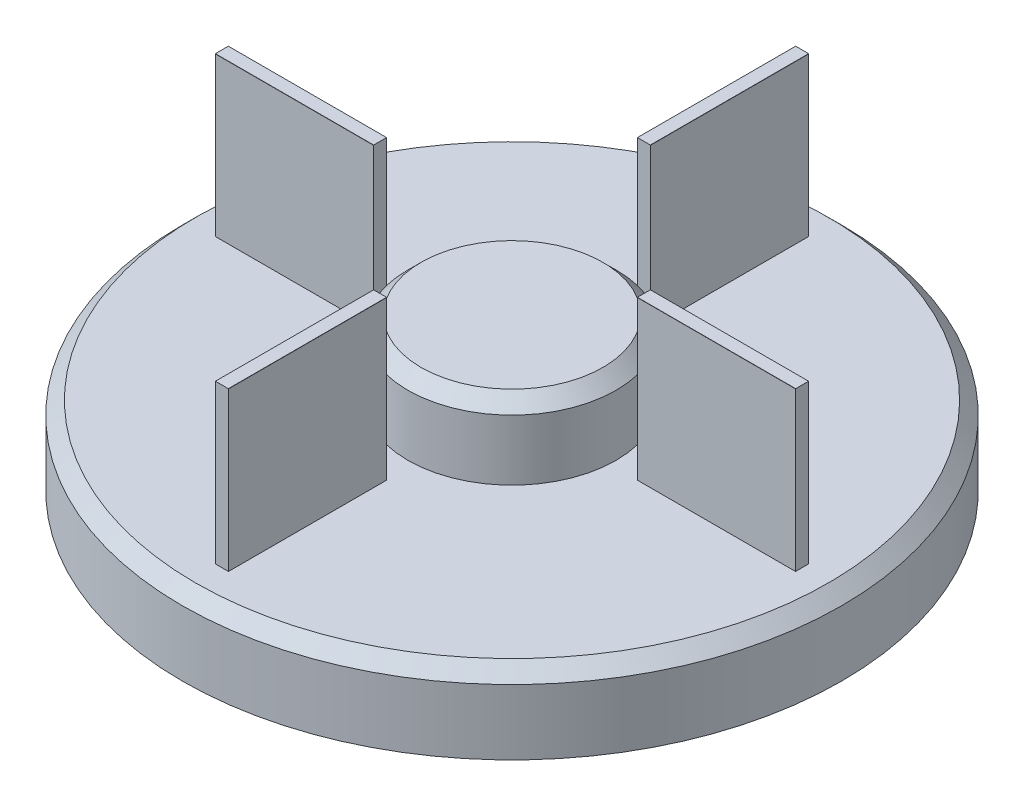
from build123d import *
from build123d.topology import SkipClean

# Parameters (mm, degrees)
SKETCH1_R           = 25
BOSS_EXTRUDE1_DEPTH = 5.95
SKETCH2_R           = 7.9
BOSS_EXTRUDE2_DEPTH = 5.6
CHAMFER2_SIZE       = 1
SKETCH4_W           = 12
SKETCH4_H           = 1
SKETCH4_W_2         = 1
SKETCH4_H_2         = 12
BOSS_EXTRUDE3_DEPTH = 12
CHAMFER3_SIZE       = 1
CHAMFER4_SIZE       = 0.01
SKETCH5_R           = 24
SKETCH5_R_2         = 8
CUT_EXTRUDE5_DEPTH  = 2
FILLET1_R           = 10
SKETCH6_R           = 2
CUT_EXTRUDE6_DEPTH  = 5
THREAD1_PITCH       = 1


with BuildPart() as part:
    # Sketch1 → Boss-Extrude1 (new body)
    with BuildSketch(Plane(origin=(0, 0, 0), x_dir=(1, 0, 0), z_dir=(0, 1, 0))):
        with Locations(Location((0, 0, 0), (0, 0, 270))):
            Circle(SKETCH1_R)
    extrude(amount=BOSS_EXTRUDE1_DEPTH)

    # Sketch2 → Boss-Extrude2 (add)
    with BuildSketch(Plane(origin=(0, 5.95, 0), x_dir=(1, 0, 0), z_dir=(0, 1, 0))):
        with Locations(Location((0, 0, 0), (0, 0, 270))):
            Circle(SKETCH2_R)
    extrude(amount=BOSS_EXTRUDE2_DEPTH)

    # Chamfer2
    chamfer2_edges = [part.edges().sort_by_distance(p)[0] for p in [
        (0, 5.95, -25),
    ]]
    chamfer(chamfer2_edges, length=CHAMFER2_SIZE)

    # Sketch4 → Boss-Extrude3 (add)
    with BuildSketch(Plane(origin=(0, 5.95, 0), x_dir=(1, 0, 0), z_dir=(0, 1, 0))):
        with Locations((-16, 0)):
            Rectangle(SKETCH4_W, SKETCH4_H)
        with Locations((0, -16)):
            Rectangle(SKETCH4_W_2, SKETCH4_H_2)
        with Locations((0, 16)):
            Rectangle(SKETCH4_W_2, SKETCH4_H_2)
        with Locations((16, 0)):
            Rectangle(SKETCH4_W, SKETCH4_H)
    extrude(amount=BOSS_EXTRUDE3_DEPTH)

    # Chamfer3
    chamfer3_edges = [part.edges().sort_by_distance(p)[0] for p in [
        (0, 11.55, -7.9),
    ]]
    chamfer(chamfer3_edges, length=CHAMFER3_SIZE)

    # Chamfer4
    chamfer4_edges = [part.edges().sort_by_distance(p)[0] for p in [
        (0.5, 17.95, 16),
        (-0.5, 17.95, 16),
        (-16, 17.95, -0.5),
        (-16, 17.95, 0.5),
        (0.5, 17.95, -16),
        (-0.5, 17.95, -16),
        (16, 17.95, 0.5),
        (16, 17.95, -0.5),
    ]]
    chamfer(chamfer4_edges, length=CHAMFER4_SIZE)

    # Sketch5 → Cut-Extrude5 (cut)
    with BuildSketch(Plane(origin=(0, 0, 0), x_dir=(-1, 0, 0), z_dir=(0, -1, 0))):
        with Locations(Location((0, 0, 0), (0, 0, 90))):
            Circle(SKETCH5_R)
        with Locations(Location((0, 0, 0), (0, 0, 90))):
            Circle(SKETCH5_R_2, mode=Mode.SUBTRACT)
    extrude(amount=-CUT_EXTRUDE5_DEPTH, mode=Mode.SUBTRACT)

    # Fillet1
    # the kernel refuses this fillet: 10 mm, written as the material it takes off along each edge
    with BuildSketch(Plane(origin=(0, 0, 0), x_dir=(0, 0, -1), z_dir=(-1, 0, 0))) as fillet1_piece_1:
        with BuildLine():
            CenterArc((2, -10), FILLET1_R, 53.130102354, 36.869897646)
            Line((2, 0), (2, 0.2))
            Line((2, 0.2), (8, 0.2))
            Line((8, 0.2), (8.2, 0))
            ThreePointArc((8.2, 0), (8.2, -1), (8.12, -1.84))
            Line((8.12, -1.84), (8, -2))
        make_face()
    revolve(axis=Axis((0, 0, 0), (0, -1, 0)), mode=Mode.SUBTRACT)

    # Sketch6 → Cut-Extrude6 (cut)
    with BuildSketch(Plane.XZ):
        with Locations(Location((0, 0, 0), (0, 0, 270))):
            Circle(SKETCH6_R)
    extrude(amount=-CUT_EXTRUDE6_DEPTH, mode=Mode.SUBTRACT)

    # Thread1: the profile of Thread Profile1 profile screwed along a right-hand helix of 10 turns, 8 arcs to a turn; built about Z, then put on its axis
    with SkipClean():  # the faces are left unmerged after this step: merging them gives an invalid solid
        thread1_z = Axis((0, 0, 0), (0, 0, 1))
        thread1_corners = [(1.9997, 0, -0.000173205), (2.541265875, 0, 0.312499999), (2.541265875, 0, 0.437499999), (1.9997, 0, 0.750173202)]
        with BuildLine(mode=Mode.PRIVATE) as thread1_profile:
            Line(thread1_corners[0], thread1_corners[1])
            Line(thread1_corners[1], thread1_corners[2])
            Line(thread1_corners[2], thread1_corners[3])
            Line(thread1_corners[3], thread1_corners[0])
        thread1_cap = Face(thread1_profile.wire())
        thread1_turn_angles = [0, 22.5, 45, 67.5, 90, 112.5, 135, 157.5, 180, 202.5, 225, 247.5, 270, 292.5, 315, 337.5, 360]
        thread1_turn_weights = [1, 0.9238795325112867, 1, 0.9238795325112867, 1, 0.9238795325112867, 1, 0.9238795325112867, 1, 0.9238795325112867, 1, 0.9238795325112867, 1, 0.9238795325112867, 1, 0.9238795325112867, 1]
        thread1_turn_rails = [Edge.make_bspline([Vector(p[0], p[1], 0).rotate(thread1_z, thread1_turn_angles[k]) / thread1_turn_weights[k] + Vector(0, 0, p[2] + THREAD1_PITCH * thread1_turn_angles[k] / 360) for k in range(17)], [0, 0, 0, 1, 1, 2, 2, 3, 3, 4, 4, 5, 5, 6, 6, 7, 7, 8, 8, 8], 2, thread1_turn_weights) for p in thread1_corners]
        thread1_turn_sides = [Face.make_surface_from_curves(thread1_turn_rails[p[0]], thread1_turn_rails[p[1]]) for p in [(0, 1), (1, 2), (2, 3), (3, 0)]]
        thread1 = Plane(origin=(0, 0, 0), x_dir=(1, 0, 0), z_dir=(0, 1, 0)) * Solid(Shell([*[p.moved(Location((0, 0, THREAD1_PITCH * i))) for i in range(10) for p in thread1_turn_sides], thread1_cap, thread1_cap.rotate(thread1_z, 3600).moved(Location((0, 0, THREAD1_PITCH * 3600 / 360)))]))
        add(thread1, mode=Mode.SUBTRACT)


solid = part.part
